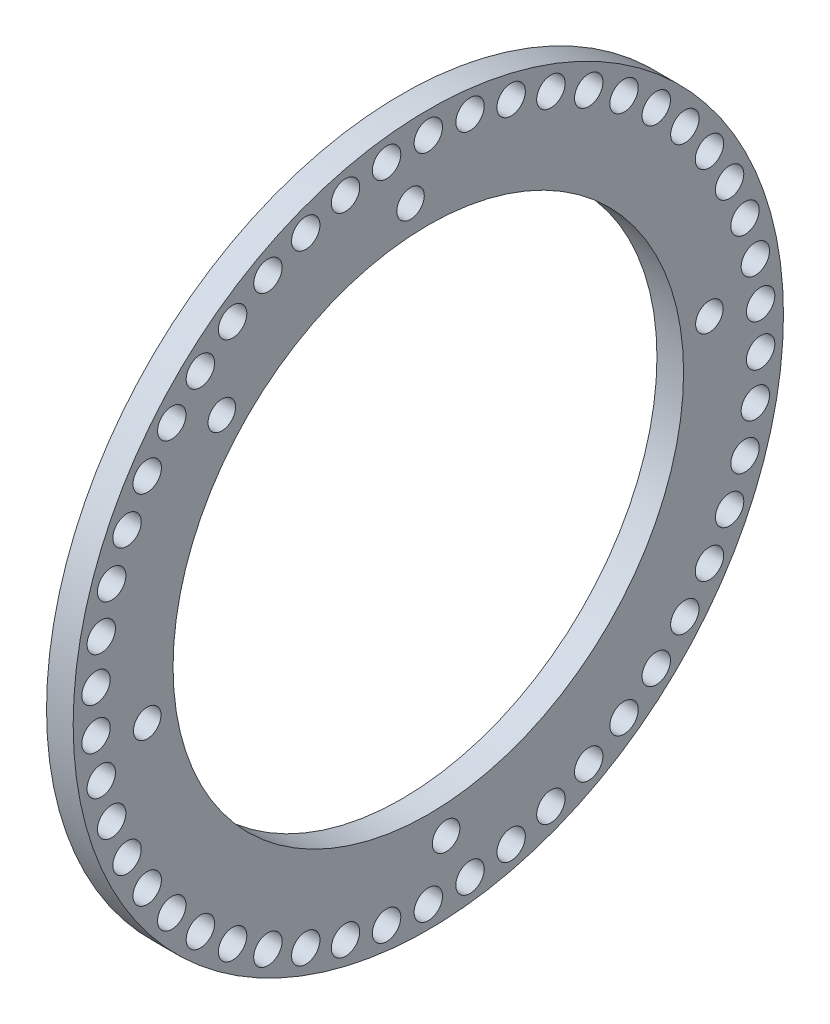
from build123d import *

# Parameters (mm, degrees)
SKETCH1_R           = 40
SKETCH1_R_2         = 1.6
SKETCH1_R_3         = 28.75
SKETCH1_R_4         = 1.55
BOSS_EXTRUDE4_DEPTH = 3


with BuildPart() as part:
    # Sketch1 → Boss-Extrude4 (new body)
    with BuildSketch(Plane(origin=(0, 0, 0), x_dir=(0, 0, -1), z_dir=(1, 0, 0))):
        Circle(SKETCH1_R)
        with Locations((0, 37.5)):
            Circle(SKETCH1_R_2, mode=Mode.SUBTRACT)
        Circle(SKETCH1_R_3, mode=Mode.SUBTRACT)
        with Locations((4.699996259, 37.204301299)):
            Circle(SKETCH1_R_2, mode=Mode.SUBTRACT)
        with Locations((9.325870769, 36.321868542)):
            Circle(SKETCH1_R_2, mode=Mode.SUBTRACT)
        with Locations((13.804670726, 34.866618221)):
            Circle(SKETCH1_R_2, mode=Mode.SUBTRACT)
        with Locations((18.065762779, 32.861500502)):
            Circle(SKETCH1_R_2, mode=Mode.SUBTRACT)
        with Locations((22.041946961, 30.338137289)):
            Circle(SKETCH1_R_2, mode=Mode.SUBTRACT)
        with Locations((25.670516472, 27.336323528)):
            Circle(SKETCH1_R_2, mode=Mode.SUBTRACT)
        with Locations((28.894246604, 23.903399616)):
            Circle(SKETCH1_R_2, mode=Mode.SUBTRACT)
        with Locations((31.662297206, 20.093504812)):
            Circle(SKETCH1_R_2, mode=Mode.SUBTRACT)
        with Locations((33.931014467, 15.966723434)):
            Circle(SKETCH1_R_2, mode=Mode.SUBTRACT)
        with Locations((35.664619361, 11.588137289)):
            Circle(SKETCH1_R_2, mode=Mode.SUBTRACT)
        with Locations((36.835771902, 7.026799297)):
            Circle(SKETCH1_R_2, mode=Mode.SUBTRACT)
        with Locations((37.426002316, 2.354644482)):
            Circle(SKETCH1_R_2, mode=Mode.SUBTRACT)
        with Locations((37.426002316, -2.354644482)):
            Circle(SKETCH1_R_2, mode=Mode.SUBTRACT)
        with Locations((36.835771902, -7.026799297)):
            Circle(SKETCH1_R_2, mode=Mode.SUBTRACT)
        with Locations((35.664619361, -11.588137289)):
            Circle(SKETCH1_R_2, mode=Mode.SUBTRACT)
        with Locations((33.931014467, -15.966723434)):
            Circle(SKETCH1_R_2, mode=Mode.SUBTRACT)
        with Locations((31.662297206, -20.093504812)):
            Circle(SKETCH1_R_2, mode=Mode.SUBTRACT)
        with Locations((28.894246604, -23.903399616)):
            Circle(SKETCH1_R_2, mode=Mode.SUBTRACT)
        with Locations((25.670516472, -27.336323528)):
            Circle(SKETCH1_R_2, mode=Mode.SUBTRACT)
        with Locations((22.041946961, -30.338137289)):
            Circle(SKETCH1_R_2, mode=Mode.SUBTRACT)
        with Locations((18.065762779, -32.861500502)):
            Circle(SKETCH1_R_2, mode=Mode.SUBTRACT)
        with Locations((13.804670726, -34.866618221)):
            Circle(SKETCH1_R_2, mode=Mode.SUBTRACT)
        with Locations((9.325870769, -36.321868542)):
            Circle(SKETCH1_R_2, mode=Mode.SUBTRACT)
        with Locations((4.699996259, -37.204301299)):
            Circle(SKETCH1_R_2, mode=Mode.SUBTRACT)
        with Locations((0, -37.5)):
            Circle(SKETCH1_R_2, mode=Mode.SUBTRACT)
        with Locations((-4.699996259, -37.204301299)):
            Circle(SKETCH1_R_2, mode=Mode.SUBTRACT)
        with Locations((-9.325870769, -36.321868542)):
            Circle(SKETCH1_R_2, mode=Mode.SUBTRACT)
        with Locations((-13.804670726, -34.866618221)):
            Circle(SKETCH1_R_2, mode=Mode.SUBTRACT)
        with Locations((-18.065762779, -32.861500502)):
            Circle(SKETCH1_R_2, mode=Mode.SUBTRACT)
        with Locations((-22.041946961, -30.338137289)):
            Circle(SKETCH1_R_2, mode=Mode.SUBTRACT)
        with Locations((-25.670516472, -27.336323528)):
            Circle(SKETCH1_R_2, mode=Mode.SUBTRACT)
        with Locations((-28.894246604, -23.903399616)):
            Circle(SKETCH1_R_2, mode=Mode.SUBTRACT)
        with Locations((-31.662297206, -20.093504812)):
            Circle(SKETCH1_R_2, mode=Mode.SUBTRACT)
        with Locations((-33.931014467, -15.966723434)):
            Circle(SKETCH1_R_2, mode=Mode.SUBTRACT)
        with Locations((-35.664619361, -11.588137289)):
            Circle(SKETCH1_R_2, mode=Mode.SUBTRACT)
        with Locations((-36.835771902, -7.026799297)):
            Circle(SKETCH1_R_2, mode=Mode.SUBTRACT)
        with Locations((-37.426002316, -2.354644482)):
            Circle(SKETCH1_R_2, mode=Mode.SUBTRACT)
        with Locations((-37.426002316, 2.354644482)):
            Circle(SKETCH1_R_2, mode=Mode.SUBTRACT)
        with Locations((-36.835771902, 7.026799297)):
            Circle(SKETCH1_R_2, mode=Mode.SUBTRACT)
        with Locations((-35.664619361, 11.588137289)):
            Circle(SKETCH1_R_2, mode=Mode.SUBTRACT)
        with Locations((-33.931014467, 15.966723434)):
            Circle(SKETCH1_R_2, mode=Mode.SUBTRACT)
        with Locations((-31.662297206, 20.093504812)):
            Circle(SKETCH1_R_2, mode=Mode.SUBTRACT)
        with Locations((-28.894246604, 23.903399616)):
            Circle(SKETCH1_R_2, mode=Mode.SUBTRACT)
        with Locations((-25.670516472, 27.336323528)):
            Circle(SKETCH1_R_2, mode=Mode.SUBTRACT)
        with Locations((-22.041946961, 30.338137289)):
            Circle(SKETCH1_R_2, mode=Mode.SUBTRACT)
        with Locations((-18.065762779, 32.861500502)):
            Circle(SKETCH1_R_2, mode=Mode.SUBTRACT)
        with Locations((-13.804670726, 34.866618221)):
            Circle(SKETCH1_R_2, mode=Mode.SUBTRACT)
        with Locations((-9.325870769, 36.321868542)):
            Circle(SKETCH1_R_2, mode=Mode.SUBTRACT)
        with Locations((-4.699996259, 37.204301299)):
            Circle(SKETCH1_R_2, mode=Mode.SUBTRACT)
        with Locations((-2.003478367, 31.844376742)):
            Circle(SKETCH1_R_4, mode=Mode.SUBTRACT)
        with Locations((-31.655739691, -3.999049919)):
            Circle(SKETCH1_R_4, mode=Mode.SUBTRACT)
        with Locations((2.003478367, -31.844376742)):
            Circle(SKETCH1_R_4, mode=Mode.SUBTRACT)
        with Locations((31.655739691, 3.999049919)):
            Circle(SKETCH1_R_4, mode=Mode.SUBTRACT)
        with Locations((-23.259448814, 21.842076287)):
            Circle(SKETCH1_R_4, mode=Mode.SUBTRACT)
    extrude(amount=BOSS_EXTRUDE4_DEPTH)


solid = part.part
